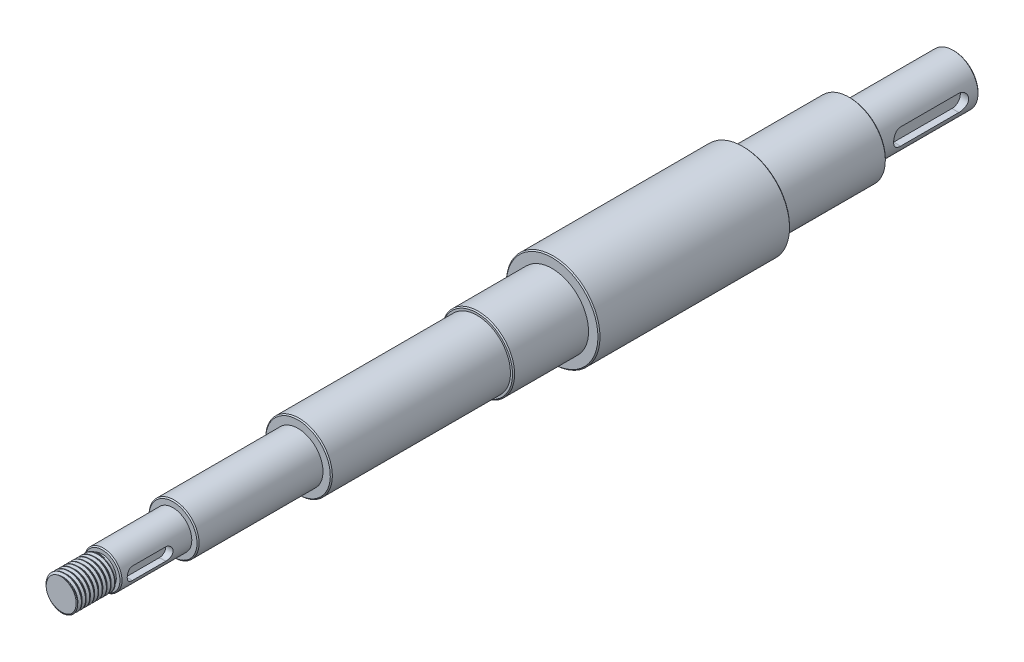
from build123d import *

# Parameters (mm, degrees)
CHAMFER1_SIZE      = 0.5
THREAD1_PITCH      = 2
THREAD1_FROM       = 5
CUT_EXTRUDE1_DEPTH = 3.5
CUT_EXTRUDE2_DEPTH = 4


with BuildPart() as part:
    # Sketch1 → Revolve1 (revolve)
    with BuildSketch(Plane(origin=(0, 0, 0), x_dir=(0, 0, -1), z_dir=(1, 0, 0)), mode=Mode.PRIVATE) as revolve1_sk:
        Polygon((214.5, 0), (214.5, 12), (164.5, 12), (164.5, 17.5), (113.5, 17.5), (113.5, 22.5), (21.5, 22.5), (21.5, 17.5), (-14.5, 17.5), (-14.5, 16), (-100.5, 16), (-100.5, 12), (-160.5, 12), (-160.5, 9), (-194.5, 9), (-194.5, 6.75), (-195.5, 6.75), (-195.5, 8), (-214.5, 8), (-214.5, 0), align=None)
    revolve(revolve1_sk.sketch.rotate(Axis((0, 0, -214.5), (0, 0, -1)), 180), axis=Axis((0, 0, -214.5), (0, 0, -1)))

    # Chamfer1
    chamfer1_edges = [part.edges().sort_by_distance(p)[0] for p in [
        (0, 8, 214.5),
        (0, 9, 194.5),
        (0, 12, 160.5),
        (0, 16, 100.5),
        (0, 17.5, 14.5),
        (0, 22.5, -21.5),
        (0, 22.5, -113.5),
        (0, 17.5, -164.5),
        (0, 12, -214.5),
    ]]
    chamfer(chamfer1_edges, length=CHAMFER1_SIZE)

    # Thread1: arcs per turn and ends read off the stored shape
    # Thread1: the profile of Thread Profile1 profile screwed along a right-hand helix through 15 turns, 10 arcs to a turn; built about Z, then put on its axis
    thread1_z = Axis((0, 0, 0), (0, 0, 1))
    thread1_corners = [(8.0003, 0, -0.000173205), (8.0003, 0, 1.7501732), (6.91746825, 0, 1.124999997), (6.91746825, 0, 0.624999997)]
    with BuildLine(mode=Mode.PRIVATE) as thread1_profile:
        Line(thread1_corners[0], thread1_corners[1])
        Line(thread1_corners[1], thread1_corners[2])
        Line(thread1_corners[2], thread1_corners[3])
        Line(thread1_corners[3], thread1_corners[0])
    thread1_cap = Face(thread1_profile.wire())
    thread1_turn_angles = [0, 18, 36, 54, 72, 90, 108, 126, 144, 162, 180, 198, 216, 234, 252, 270, 288, 306, 324, 342, 360]
    thread1_turn_weights = [1, 0.9510565162951535, 1, 0.9510565162951535, 1, 0.9510565162951535, 1, 0.9510565162951535, 1, 0.9510565162951535, 1, 0.9510565162951535, 1, 0.9510565162951535, 1, 0.9510565162951535, 1, 0.9510565162951535, 1, 0.9510565162951535, 1]
    thread1_turn_rails = [Edge.make_bspline([Vector(p[0], p[1], 0).rotate(thread1_z, thread1_turn_angles[k]) / thread1_turn_weights[k] + Vector(0, 0, p[2] + THREAD1_PITCH * thread1_turn_angles[k] / 360) for k in range(21)], [0, 0, 0, 1, 1, 2, 2, 3, 3, 4, 4, 5, 5, 6, 6, 7, 7, 8, 8, 9, 9, 10, 10, 10], 2, thread1_turn_weights) for p in thread1_corners]
    thread1_turn_sides = [Face.make_surface_from_curves(thread1_turn_rails[p[0]], thread1_turn_rails[p[1]]) for p in [(0, 1), (1, 2), (2, 3), (3, 0)]]
    thread1 = Plane(origin=(0, 0, 190.5), x_dir=(1, 0, 0), z_dir=(0, 0, 1)) * split(Solid(Shell([*[p.moved(Location((0, 0, THREAD1_PITCH * i))) for i in range(15) for p in thread1_turn_sides], thread1_cap, thread1_cap.rotate(thread1_z, 5400).moved(Location((0, 0, THREAD1_PITCH * 5400 / 360)))])), bisect_by=Plane.XY.offset(THREAD1_FROM), keep=Keep.TOP, mode=Mode.PRIVATE)
    add(thread1, mode=Mode.SUBTRACT)

    # Sketch6 → Cut-Extrude1 (cut)
    with BuildSketch(Plane(origin=(9, 0, 0), x_dir=(0, 0, -1), z_dir=(1, 0, 0))):
        with BuildLine():
            Line((-188.5, 3), (-172.5, 3))
            ThreePointArc((-172.5, 3), (-169.5, 0), (-172.5, -3))
            Line((-172.5, -3), (-188.5, -3))
            ThreePointArc((-188.5, -3), (-191.5, 0), (-188.5, 3))
        make_face()
    extrude(amount=-CUT_EXTRUDE1_DEPTH, mode=Mode.SUBTRACT)

    # Sketch7 → Cut-Extrude2 (cut)
    with BuildSketch(Plane(origin=(12, 0, 0), x_dir=(0, 0, -1), z_dir=(1, 0, 0))):
        with BuildLine():
            Line((177.5, 4), (205.5, 4))
            ThreePointArc((205.5, 4), (209.5, 0), (205.5, -4))
            Line((205.5, -4), (177.5, -4))
            ThreePointArc((177.5, -4), (173.5, 0), (177.5, 4))
        make_face()
    extrude(amount=-CUT_EXTRUDE2_DEPTH, mode=Mode.SUBTRACT)


solid = part.part
